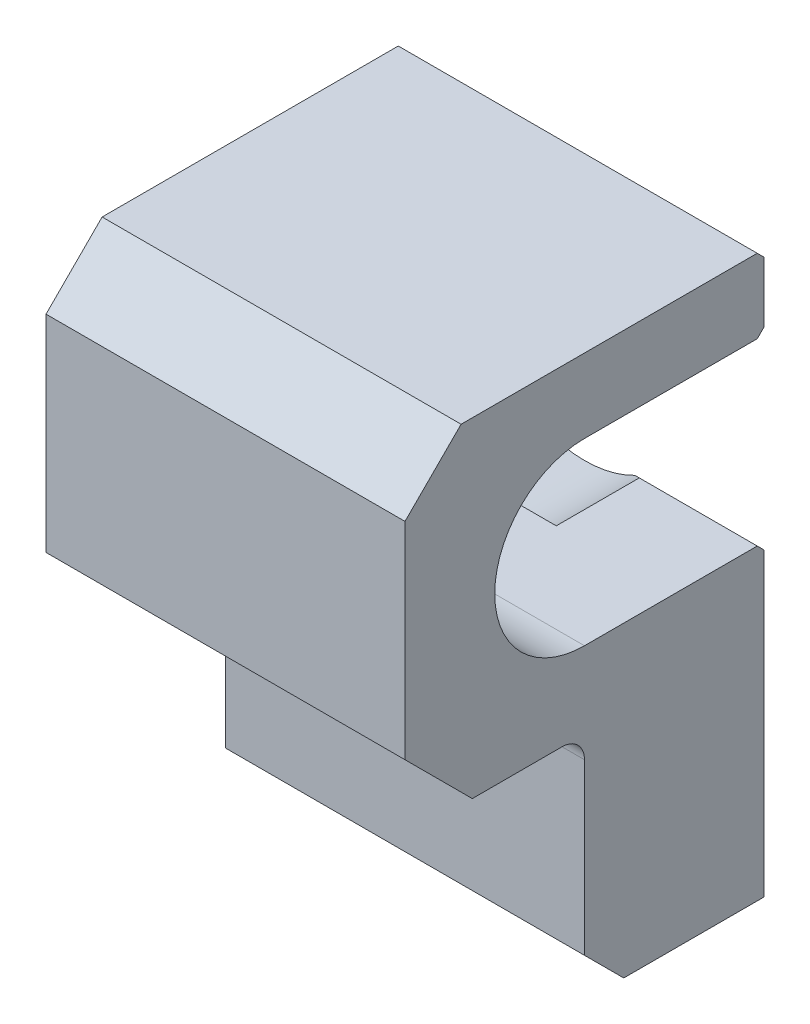
from build123d import *

# Parameters (mm, degrees)
BOSS_EXTRUDE1_DEPTH             = 8
BOSS_EXTRUDE1_DEPTH_BACK        = 8
SKETCH3_R                       = 4.85
CUT_EXTRUDE1_DEPTH              = 4
TAP_DRILL_FOR_1_4_20_TAP1_D     = 5.1054
TAP_DRILL_FOR_1_4_20_TAP1_DEPTH = 5.466183098
TAP_DRILL_FOR_1_4_20_TAP1_TIP   = 1.533816902
CHAMFER1_SIZE                   = 1
THREAD1_PITCH                   = 1.27


with BuildPart() as part:
    # Sketch2 → Boss-Extrude1 (new, two sides: drawn at the far end of the back side and taken through both)
    with BuildSketch(Plane(origin=(0, 0, 0), x_dir=(0, 0, -1), z_dir=(1, 0, 0)).offset(-BOSS_EXTRUDE1_DEPTH_BACK)):
        with BuildLine():
            Line((0, -0.3), (0, -13.7))
            Line((0, -13.7), (-6.25, -13.7))
            Line((-6.25, -13.7), (-8, -11.95))
            Line((-8, -11.95), (-8, -4.4))
            ThreePointArc((-8, -4.4), (-8.292893219, -3.692893219), (-9, -3.4))
            Line((-9, -3.4), (-13, -3.4))
            Line((-13, -3.4), (-16, -0.4))
            Line((-16, -0.4), (-16, 8.8))
            Line((-16, 8.8), (-13.5, 11.3))
            Line((-13.5, 11.3), (-0.3, 11.3))
            Line((-0.3, 11.3), (0, 11))
            Line((0, 11), (0, 8.3))
            Line((0, 8.3), (-0.3, 8))
            Line((-0.3, 8), (-8, 8))
            ThreePointArc((-8, 8), (-12, 4), (-8, 0))
            Line((-8, 0), (-0.3, 0))
            Line((-0.3, 0), (0, -0.3))
        make_face()
    extrude(amount=BOSS_EXTRUDE1_DEPTH + BOSS_EXTRUDE1_DEPTH_BACK)

    # Sketch3 → Cut-Extrude1 (cut)
    with BuildSketch(Plane(origin=(0, 0, 0), x_dir=(-1, 0, 0), z_dir=(0, 0, -1))):
        with Locations((0, 4)):
            Circle(SKETCH3_R)
    extrude(amount=-CUT_EXTRUDE1_DEPTH, mode=Mode.SUBTRACT)

    # Tap Drill for 1/4-20 Tap1
    with Locations(Plane(origin=(0, 0, 0), x_dir=(-1, 0, 0), z_dir=(0, 0, -1))):
        with Locations((0, -6.7)):
            Hole(TAP_DRILL_FOR_1_4_20_TAP1_D / 2, depth=TAP_DRILL_FOR_1_4_20_TAP1_DEPTH)
            with Locations((0, 0, -(TAP_DRILL_FOR_1_4_20_TAP1_DEPTH + TAP_DRILL_FOR_1_4_20_TAP1_TIP / 2))):  # 118° drill point
                Cone(0, TAP_DRILL_FOR_1_4_20_TAP1_D / 2, TAP_DRILL_FOR_1_4_20_TAP1_TIP, mode=Mode.SUBTRACT)

    # Chamfer1
    chamfer1_edges = [part.edges().sort_by_distance(p)[0] for p in [
        (-2.5527, -6.7, 0),
    ]]
    chamfer(chamfer1_edges, length=CHAMFER1_SIZE)

    # Thread1: the profile of Thread Profile1 profile screwed along a right-hand helix of 5.091483 turns, 8 arcs to a turn; built about Z, then put on its axis
    thread1_z = Axis((0, 0, 0), (0, 0, 1))
    thread1_corners = [(2.5524, 0, -0.000173205), (3.240107661, 0, 0.396874998), (3.240107661, 0, 0.555624998), (2.5524, 0, 0.952673202)]
    with BuildLine(mode=Mode.PRIVATE) as thread1_profile:
        Line(thread1_corners[0], thread1_corners[1])
        Line(thread1_corners[1], thread1_corners[2])
        Line(thread1_corners[2], thread1_corners[3])
        Line(thread1_corners[3], thread1_corners[0])
    thread1_cap = Face(thread1_profile.wire())
    thread1_turn_angles = [0, 22.5, 45, 67.5, 90, 112.5, 135, 157.5, 180, 202.5, 225, 247.5, 270, 292.5, 315, 337.5, 360]
    thread1_turn_weights = [1, 0.9238795325112867, 1, 0.9238795325112867, 1, 0.9238795325112867, 1, 0.9238795325112867, 1, 0.9238795325112867, 1, 0.9238795325112867, 1, 0.9238795325112867, 1, 0.9238795325112867, 1]
    thread1_turn_rails = [Edge.make_bspline([Vector(p[0], p[1], 0).rotate(thread1_z, thread1_turn_angles[k]) / thread1_turn_weights[k] + Vector(0, 0, p[2] + THREAD1_PITCH * thread1_turn_angles[k] / 360) for k in range(17)], [0, 0, 0, 1, 1, 2, 2, 3, 3, 4, 4, 5, 5, 6, 6, 7, 7, 8, 8, 8], 2, thread1_turn_weights) for p in thread1_corners]
    thread1_turn_sides = [Face.make_surface_from_curves(thread1_turn_rails[p[0]], thread1_turn_rails[p[1]]) for p in [(0, 1), (1, 2), (2, 3), (3, 0)]]
    thread1_last_angles = [1800, 1816.466895752, 1832.933791505]
    thread1_last_weights = [1, 0.9589836726700931, 1]
    thread1_last_rails = [Edge.make_bspline([Vector(p[0], p[1], 0).rotate(thread1_z, thread1_last_angles[k]) / thread1_last_weights[k] + Vector(0, 0, p[2] + THREAD1_PITCH * thread1_last_angles[k] / 360) for k in range(3)], [0, 0, 0, 1, 1, 1], 2, thread1_last_weights) for p in thread1_corners]
    thread1_last_sides = [Face.make_surface_from_curves(thread1_last_rails[p[0]], thread1_last_rails[p[1]]) for p in [(0, 1), (1, 2), (2, 3), (3, 0)]]
    thread1 = Plane(origin=(0, -6.7, -1), x_dir=(1, 0, 0), z_dir=(0, 0, 1)) * Solid(Shell([*[p.moved(Location((0, 0, THREAD1_PITCH * i))) for i in range(5) for p in thread1_turn_sides], *thread1_last_sides, thread1_cap, thread1_cap.rotate(thread1_z, 1832.933791505).moved(Location((0, 0, THREAD1_PITCH * 1832.933791505 / 360)))]))
    add(thread1, mode=Mode.SUBTRACT)


solid = part.part
